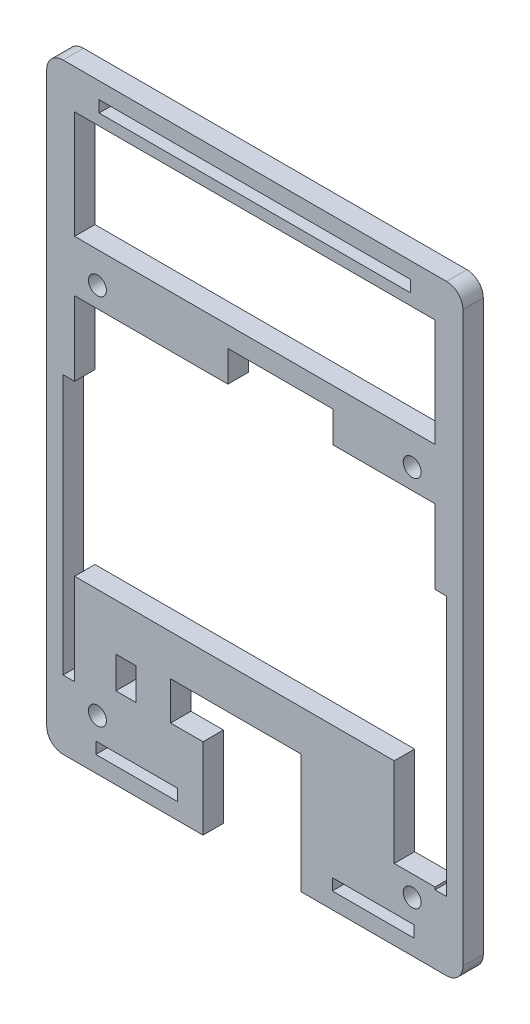
from build123d import *

# Parameters (mm, degrees)
SKETCH1_R           = 1.397
SKETCH1_W           = 12.7
SKETCH1_H           = 1.8034
SKETCH1_W_2         = 3.175
SKETCH1_H_2         = 4.953
SKETCH1_W_3         = 56.134
SKETCH1_H_3         = 16.7894
SKETCH1_W_4         = 48.514
BOSS_EXTRUDE1_DEPTH = 3.175


with BuildPart() as part:
    # Sketch1 → Boss-Extrude1 (new body)
    with BuildSketch(Plane.XY):
        with BuildLine():
            Line((35.2679, 14.224), (35.2679, -4.3434))
            Line((35.2679, -4.3434), (57.9374, -4.3434))
            ThreePointArc((57.9374, -4.3434), (59.733451224, -3.599451224), (60.4774, -1.8034))
            Line((60.4774, -1.8034), (60.4774, 86.7664))
            ThreePointArc((60.4774, 86.7664), (59.733451224, 88.562451224), (57.9374, 89.3064))
            Line((57.9374, 89.3064), (-1.8034, 89.3064))
            ThreePointArc((-1.8034, 89.3064), (-3.599451224, 88.562451224), (-4.3434, 86.7664))
            Line((-4.3434, 86.7664), (-4.3434, -1.8034))
            ThreePointArc((-4.3434, -1.8034), (-3.599451224, -3.599451224), (-1.8034, -4.3434))
            Line((-1.8034, -4.3434), (20.0025, -4.3434))
            Line((20.0025, -4.3434), (20.0025, 8.255))
            Line((20.0025, 8.255), (14.9479, 8.255))
            Line((14.9479, 8.255), (14.9479, 14.224))
            Line((14.9479, 14.224), (35.2679, 14.224))
        make_face()
        with Locations((3.556, 3.556)):
            Circle(SKETCH1_R, mode=Mode.SUBTRACT)
        with Locations((9.652, -0.9017)):
            Rectangle(SKETCH1_W, SKETCH1_H, mode=Mode.SUBTRACT)
        with Locations((8.0137, 10.8077)):
            Rectangle(SKETCH1_W_2, SKETCH1_H_2, mode=Mode.SUBTRACT)
        with Locations((46.482, -0.9017)):
            Rectangle(SKETCH1_W, SKETCH1_H, mode=Mode.SUBTRACT)
        with Locations((52.578, 3.556)):
            Circle(SKETCH1_R, mode=Mode.SUBTRACT)
        Polygon((49.784, 20.574), (0, 20.574), (0, 6.35), (-1.8034, 6.35), (-1.8034, 46.863), (0, 46.863), (0, 58.42), (23.876, 58.42), (23.876, 63.246), (40.259, 63.246), (40.259, 58.42), (56.134, 58.42), (56.134, 46.863), (57.9374, 46.863), (57.9374, 6.35), (56.134, 6.35), (56.134, 6.731), (49.784, 6.731), align=None, mode=Mode.SUBTRACT)
        with Locations((28.067, 74.8157)):
            Rectangle(SKETCH1_W_3, SKETCH1_H_3, mode=Mode.SUBTRACT)
        with Locations((28.067, 85.8647)):
            Rectangle(SKETCH1_W_4, SKETCH1_H, mode=Mode.SUBTRACT)
        with Locations((3.556, 61.595)):
            Circle(SKETCH1_R, mode=Mode.SUBTRACT)
        with Locations((52.578, 61.595)):
            Circle(SKETCH1_R, mode=Mode.SUBTRACT)
    extrude(amount=BOSS_EXTRUDE1_DEPTH)


solid = part.part
